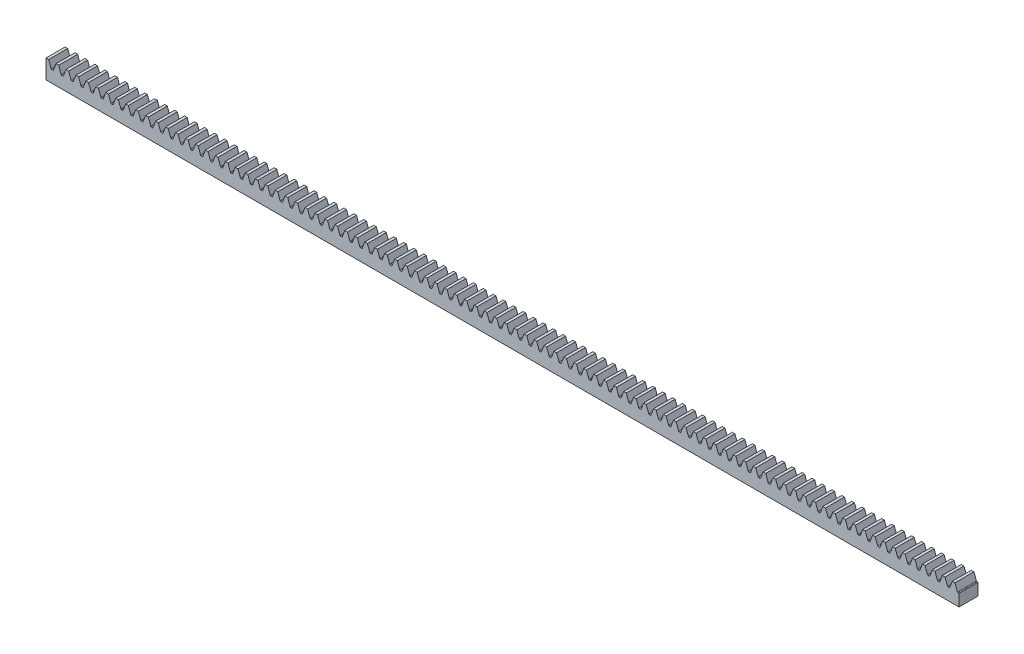
from build123d import *

# Parameters (mm, degrees)
BOSS_EXTRUDE1_DEPTH      = 152.4
BOSS_EXTRUDE1_DEPTH_BACK = 152.4
SKETCH3_W                = 6.35
SKETCH3_H                = 6.35
CUT_EXTRUDE1_DEPTH       = 153.466131485
FILLET1_R                = 0.210289869
LPATTERN1_START          = -3.175
LPATTERN1_DEPTH          = 6.35


# Read off the part's stored shape, not the designer's step: LPattern1
with BuildPart() as part:
    # Sketch3 → Boss-Extrude1 (new, two sides: drawn at the far end of the back side and taken through both)
    with BuildSketch(Plane(origin=(0, 0, 0), x_dir=(0, 0, -1), z_dir=(1, 0, 0)).offset(-BOSS_EXTRUDE1_DEPTH_BACK)):
        Rectangle(SKETCH3_W, SKETCH3_H)
    extrude(amount=BOSS_EXTRUDE1_DEPTH + BOSS_EXTRUDE1_DEPTH_BACK)

    # Sketch4 → Cut-Extrude1 (cut, symmetric)
    with BuildSketch(Plane.XY):
        Polygon((-151.507973663, 3.175), (-150.642039946, 0.795866667), (-149.941073717, 0.795866667), (-149.07514, 3.175), align=None)
    extrude(amount=CUT_EXTRUDE1_DEPTH, both=True, mode=Mode.SUBTRACT)

    # Fillet1
    fillet1_edges = [part.edges().sort_by_distance(p)[0] for p in [
        (-149.941073717, 0.795866667, 0),
        (-150.642039946, 0.795866667, 0),
    ]]
    fillet(fillet1_edges, radius=FILLET1_R)

    # LPattern1 outline → LPattern1 (cut)
    with BuildSketch(Plane.XY.offset(LPATTERN1_START)):
        with BuildLine():
            ThreePointArc((-147.367541232, 0.934233164), (-147.290550708, 0.83389716), (-147.169933395, 0.795866667))
            Line((-147.169933395, 0.795866667), (-146.763460268, 0.795866667))
            ThreePointArc((-146.763460268, 0.795866667), (-146.642842955, 0.83389716), (-146.56585243, 0.934233164))
            Line((-146.56585243, 0.934233164), (-145.75028, 3.175))
            Line((-145.75028, 3.175), (-148.183113663, 3.175))
            Line((-148.183113663, 3.175), (-147.367541232, 0.934233164))
        make_face()
        with BuildLine():
            Line((152.4, 3.175), (151.054286337, 3.175))
            Line((151.054286337, 3.175), (151.869858768, 0.934233164))
            ThreePointArc((151.869858768, 0.934233164), (151.946849292, 0.83389716), (152.067466605, 0.795866667))
            Line((152.067466605, 0.795866667), (152.4, 0.795866667))
            Line((152.4, 0.795866667), (152.4, 3.175))
        make_face()
        with BuildLine():
            Line((150.16226, 3.175), (147.729426337, 3.175))
            Line((147.729426337, 3.175), (148.544998768, 0.934233164))
            ThreePointArc((148.544998768, 0.934233164), (148.621989292, 0.83389716), (148.742606605, 0.795866667))
            Line((148.742606605, 0.795866667), (149.149079732, 0.795866667))
            ThreePointArc((149.149079732, 0.795866667), (149.269697045, 0.83389716), (149.34668757, 0.934233164))
            Line((149.34668757, 0.934233164), (150.16226, 3.175))
        make_face()
        with BuildLine():
            Line((146.8374, 3.175), (144.404566337, 3.175))
            Line((144.404566337, 3.175), (145.220138768, 0.934233164))
            ThreePointArc((145.220138768, 0.934233164), (145.297129292, 0.83389716), (145.417746605, 0.795866667))
            Line((145.417746605, 0.795866667), (145.824219732, 0.795866667))
            ThreePointArc((145.824219732, 0.795866667), (145.944837045, 0.83389716), (146.02182757, 0.934233164))
            Line((146.02182757, 0.934233164), (146.8374, 3.175))
        make_face()
        with BuildLine():
            Line((143.51254, 3.175), (141.079706337, 3.175))
            Line((141.079706337, 3.175), (141.895278768, 0.934233164))
            ThreePointArc((141.895278768, 0.934233164), (141.972269292, 0.83389716), (142.092886605, 0.795866667))
            Line((142.092886605, 0.795866667), (142.499359732, 0.795866667))
            ThreePointArc((142.499359732, 0.795866667), (142.619977045, 0.83389716), (142.69696757, 0.934233164))
            Line((142.69696757, 0.934233164), (143.51254, 3.175))
        make_face()
        with BuildLine():
            Line((140.18768, 3.175), (137.754846337, 3.175))
            Line((137.754846337, 3.175), (138.570418768, 0.934233164))
            ThreePointArc((138.570418768, 0.934233164), (138.647409292, 0.83389716), (138.768026605, 0.795866667))
            Line((138.768026605, 0.795866667), (139.174499732, 0.795866667))
            ThreePointArc((139.174499732, 0.795866667), (139.295117045, 0.83389716), (139.37210757, 0.934233164))
            Line((139.37210757, 0.934233164), (140.18768, 3.175))
        make_face()
        with BuildLine():
            Line((136.86282, 3.175), (134.429986337, 3.175))
            Line((134.429986337, 3.175), (135.245558768, 0.934233164))
            ThreePointArc((135.245558768, 0.934233164), (135.322549292, 0.83389716), (135.443166605, 0.795866667))
            Line((135.443166605, 0.795866667), (135.849639732, 0.795866667))
            ThreePointArc((135.849639732, 0.795866667), (135.970257045, 0.83389716), (136.04724757, 0.934233164))
            Line((136.04724757, 0.934233164), (136.86282, 3.175))
        make_face()
        with BuildLine():
            Line((133.53796, 3.175), (131.105126337, 3.175))
            Line((131.105126337, 3.175), (131.920698768, 0.934233164))
            ThreePointArc((131.920698768, 0.934233164), (131.997689292, 0.83389716), (132.118306605, 0.795866667))
            Line((132.118306605, 0.795866667), (132.524779732, 0.795866667))
            ThreePointArc((132.524779732, 0.795866667), (132.645397045, 0.83389716), (132.72238757, 0.934233164))
            Line((132.72238757, 0.934233164), (133.53796, 3.175))
        make_face()
        with BuildLine():
            Line((130.2131, 3.175), (127.780266337, 3.175))
            Line((127.780266337, 3.175), (128.595838768, 0.934233164))
            ThreePointArc((128.595838768, 0.934233164), (128.672829292, 0.83389716), (128.793446605, 0.795866667))
            Line((128.793446605, 0.795866667), (129.199919732, 0.795866667))
            ThreePointArc((129.199919732, 0.795866667), (129.320537045, 0.83389716), (129.39752757, 0.934233164))
            Line((129.39752757, 0.934233164), (130.2131, 3.175))
        make_face()
        with BuildLine():
            Line((126.88824, 3.175), (124.455406337, 3.175))
            Line((124.455406337, 3.175), (125.270978768, 0.934233164))
            ThreePointArc((125.270978768, 0.934233164), (125.347969292, 0.83389716), (125.468586605, 0.795866667))
            Line((125.468586605, 0.795866667), (125.875059732, 0.795866667))
            ThreePointArc((125.875059732, 0.795866667), (125.995677045, 0.83389716), (126.07266757, 0.934233164))
            Line((126.07266757, 0.934233164), (126.88824, 3.175))
        make_face()
        with BuildLine():
            Line((123.56338, 3.175), (121.130546337, 3.175))
            Line((121.130546337, 3.175), (121.946118768, 0.934233164))
            ThreePointArc((121.946118768, 0.934233164), (122.023109292, 0.83389716), (122.143726605, 0.795866667))
            Line((122.143726605, 0.795866667), (122.550199732, 0.795866667))
            ThreePointArc((122.550199732, 0.795866667), (122.670817045, 0.83389716), (122.74780757, 0.934233164))
            Line((122.74780757, 0.934233164), (123.56338, 3.175))
        make_face()
        with BuildLine():
            Line((120.23852, 3.175), (117.805686337, 3.175))
            Line((117.805686337, 3.175), (118.621258768, 0.934233164))
            ThreePointArc((118.621258768, 0.934233164), (118.698249292, 0.83389716), (118.818866605, 0.795866667))
            Line((118.818866605, 0.795866667), (119.225339732, 0.795866667))
            ThreePointArc((119.225339732, 0.795866667), (119.345957045, 0.83389716), (119.42294757, 0.934233164))
            Line((119.42294757, 0.934233164), (120.23852, 3.175))
        make_face()
        with BuildLine():
            Line((116.91366, 3.175), (114.480826337, 3.175))
            Line((114.480826337, 3.175), (115.296398768, 0.934233164))
            ThreePointArc((115.296398768, 0.934233164), (115.373389292, 0.83389716), (115.494006605, 0.795866667))
            Line((115.494006605, 0.795866667), (115.900479732, 0.795866667))
            ThreePointArc((115.900479732, 0.795866667), (116.021097045, 0.83389716), (116.09808757, 0.934233164))
            Line((116.09808757, 0.934233164), (116.91366, 3.175))
        make_face()
        with BuildLine():
            Line((113.5888, 3.175), (111.155966337, 3.175))
            Line((111.155966337, 3.175), (111.971538768, 0.934233164))
            ThreePointArc((111.971538768, 0.934233164), (112.048529292, 0.83389716), (112.169146605, 0.795866667))
            Line((112.169146605, 0.795866667), (112.575619732, 0.795866667))
            ThreePointArc((112.575619732, 0.795866667), (112.696237045, 0.83389716), (112.77322757, 0.934233164))
            Line((112.77322757, 0.934233164), (113.5888, 3.175))
        make_face()
        with BuildLine():
            Line((110.26394, 3.175), (107.831106337, 3.175))
            Line((107.831106337, 3.175), (108.646678768, 0.934233164))
            ThreePointArc((108.646678768, 0.934233164), (108.723669292, 0.83389716), (108.844286605, 0.795866667))
            Line((108.844286605, 0.795866667), (109.250759732, 0.795866667))
            ThreePointArc((109.250759732, 0.795866667), (109.371377045, 0.83389716), (109.44836757, 0.934233164))
            Line((109.44836757, 0.934233164), (110.26394, 3.175))
        make_face()
        with BuildLine():
            Line((106.93908, 3.175), (104.506246337, 3.175))
            Line((104.506246337, 3.175), (105.321818768, 0.934233164))
            ThreePointArc((105.321818768, 0.934233164), (105.398809292, 0.83389716), (105.519426605, 0.795866667))
            Line((105.519426605, 0.795866667), (105.925899732, 0.795866667))
            ThreePointArc((105.925899732, 0.795866667), (106.046517045, 0.83389716), (106.12350757, 0.934233164))
            Line((106.12350757, 0.934233164), (106.93908, 3.175))
        make_face()
        with BuildLine():
            Line((103.61422, 3.175), (101.181386337, 3.175))
            Line((101.181386337, 3.175), (101.996958768, 0.934233164))
            ThreePointArc((101.996958768, 0.934233164), (102.073949292, 0.83389716), (102.194566605, 0.795866667))
            Line((102.194566605, 0.795866667), (102.601039732, 0.795866667))
            ThreePointArc((102.601039732, 0.795866667), (102.721657045, 0.83389716), (102.79864757, 0.934233164))
            Line((102.79864757, 0.934233164), (103.61422, 3.175))
        make_face()
        with BuildLine():
            Line((100.28936, 3.175), (97.856526337, 3.175))
            Line((97.856526337, 3.175), (98.672098768, 0.934233164))
            ThreePointArc((98.672098768, 0.934233164), (98.749089292, 0.83389716), (98.869706605, 0.795866667))
            Line((98.869706605, 0.795866667), (99.276179732, 0.795866667))
            ThreePointArc((99.276179732, 0.795866667), (99.396797045, 0.83389716), (99.47378757, 0.934233164))
            Line((99.47378757, 0.934233164), (100.28936, 3.175))
        make_face()
        with BuildLine():
            Line((96.9645, 3.175), (94.531666337, 3.175))
            Line((94.531666337, 3.175), (95.347238768, 0.934233164))
            ThreePointArc((95.347238768, 0.934233164), (95.424229292, 0.83389716), (95.544846605, 0.795866667))
            Line((95.544846605, 0.795866667), (95.951319732, 0.795866667))
            ThreePointArc((95.951319732, 0.795866667), (96.071937045, 0.83389716), (96.14892757, 0.934233164))
            Line((96.14892757, 0.934233164), (96.9645, 3.175))
        make_face()
        with BuildLine():
            Line((93.63964, 3.175), (91.206806337, 3.175))
            Line((91.206806337, 3.175), (92.022378768, 0.934233164))
            ThreePointArc((92.022378768, 0.934233164), (92.099369292, 0.83389716), (92.219986605, 0.795866667))
            Line((92.219986605, 0.795866667), (92.626459732, 0.795866667))
            ThreePointArc((92.626459732, 0.795866667), (92.747077045, 0.83389716), (92.82406757, 0.934233164))
            Line((92.82406757, 0.934233164), (93.63964, 3.175))
        make_face()
        with BuildLine():
            Line((90.31478, 3.175), (87.881946337, 3.175))
            Line((87.881946337, 3.175), (88.697518768, 0.934233164))
            ThreePointArc((88.697518768, 0.934233164), (88.774509292, 0.83389716), (88.895126605, 0.795866667))
            Line((88.895126605, 0.795866667), (89.301599732, 0.795866667))
            ThreePointArc((89.301599732, 0.795866667), (89.422217045, 0.83389716), (89.49920757, 0.934233164))
            Line((89.49920757, 0.934233164), (90.31478, 3.175))
        make_face()
        with BuildLine():
            Line((86.98992, 3.175), (84.557086337, 3.175))
            Line((84.557086337, 3.175), (85.372658768, 0.934233164))
            ThreePointArc((85.372658768, 0.934233164), (85.449649292, 0.83389716), (85.570266605, 0.795866667))
            Line((85.570266605, 0.795866667), (85.976739732, 0.795866667))
            ThreePointArc((85.976739732, 0.795866667), (86.097357045, 0.83389716), (86.17434757, 0.934233164))
            Line((86.17434757, 0.934233164), (86.98992, 3.175))
        make_face()
        with BuildLine():
            Line((83.66506, 3.175), (81.232226337, 3.175))
            Line((81.232226337, 3.175), (82.047798768, 0.934233164))
            ThreePointArc((82.047798768, 0.934233164), (82.124789292, 0.83389716), (82.245406605, 0.795866667))
            Line((82.245406605, 0.795866667), (82.651879732, 0.795866667))
            ThreePointArc((82.651879732, 0.795866667), (82.772497045, 0.83389716), (82.84948757, 0.934233164))
            Line((82.84948757, 0.934233164), (83.66506, 3.175))
        make_face()
        with BuildLine():
            Line((80.3402, 3.175), (77.907366337, 3.175))
            Line((77.907366337, 3.175), (78.722938768, 0.934233164))
            ThreePointArc((78.722938768, 0.934233164), (78.799929292, 0.83389716), (78.920546605, 0.795866667))
            Line((78.920546605, 0.795866667), (79.327019732, 0.795866667))
            ThreePointArc((79.327019732, 0.795866667), (79.447637045, 0.83389716), (79.52462757, 0.934233164))
            Line((79.52462757, 0.934233164), (80.3402, 3.175))
        make_face()
        with BuildLine():
            Line((77.01534, 3.175), (74.582506337, 3.175))
            Line((74.582506337, 3.175), (75.398078768, 0.934233164))
            ThreePointArc((75.398078768, 0.934233164), (75.475069292, 0.83389716), (75.595686605, 0.795866667))
            Line((75.595686605, 0.795866667), (76.002159732, 0.795866667))
            ThreePointArc((76.002159732, 0.795866667), (76.122777045, 0.83389716), (76.19976757, 0.934233164))
            Line((76.19976757, 0.934233164), (77.01534, 3.175))
        make_face()
        with BuildLine():
            Line((73.69048, 3.175), (71.257646337, 3.175))
            Line((71.257646337, 3.175), (72.073218768, 0.934233164))
            ThreePointArc((72.073218768, 0.934233164), (72.150209292, 0.83389716), (72.270826605, 0.795866667))
            Line((72.270826605, 0.795866667), (72.677299732, 0.795866667))
            ThreePointArc((72.677299732, 0.795866667), (72.797917045, 0.83389716), (72.87490757, 0.934233164))
            Line((72.87490757, 0.934233164), (73.69048, 3.175))
        make_face()
        with BuildLine():
            Line((70.36562, 3.175), (67.932786337, 3.175))
            Line((67.932786337, 3.175), (68.748358768, 0.934233164))
            ThreePointArc((68.748358768, 0.934233164), (68.825349292, 0.83389716), (68.945966605, 0.795866667))
            Line((68.945966605, 0.795866667), (69.352439732, 0.795866667))
            ThreePointArc((69.352439732, 0.795866667), (69.473057045, 0.83389716), (69.55004757, 0.934233164))
            Line((69.55004757, 0.934233164), (70.36562, 3.175))
        make_face()
        with BuildLine():
            Line((67.04076, 3.175), (64.607926337, 3.175))
            Line((64.607926337, 3.175), (65.423498768, 0.934233164))
            ThreePointArc((65.423498768, 0.934233164), (65.500489292, 0.83389716), (65.621106605, 0.795866667))
            Line((65.621106605, 0.795866667), (66.027579732, 0.795866667))
            ThreePointArc((66.027579732, 0.795866667), (66.148197045, 0.83389716), (66.22518757, 0.934233164))
            Line((66.22518757, 0.934233164), (67.04076, 3.175))
        make_face()
        with BuildLine():
            Line((63.7159, 3.175), (61.283066337, 3.175))
            Line((61.283066337, 3.175), (62.098638768, 0.934233164))
            ThreePointArc((62.098638768, 0.934233164), (62.175629292, 0.83389716), (62.296246605, 0.795866667))
            Line((62.296246605, 0.795866667), (62.702719732, 0.795866667))
            ThreePointArc((62.702719732, 0.795866667), (62.823337045, 0.83389716), (62.90032757, 0.934233164))
            Line((62.90032757, 0.934233164), (63.7159, 3.175))
        make_face()
        with BuildLine():
            Line((60.39104, 3.175), (57.958206337, 3.175))
            Line((57.958206337, 3.175), (58.773778768, 0.934233164))
            ThreePointArc((58.773778768, 0.934233164), (58.850769292, 0.83389716), (58.971386605, 0.795866667))
            Line((58.971386605, 0.795866667), (59.377859732, 0.795866667))
            ThreePointArc((59.377859732, 0.795866667), (59.498477045, 0.83389716), (59.57546757, 0.934233164))
            Line((59.57546757, 0.934233164), (60.39104, 3.175))
        make_face()
        with BuildLine():
            Line((57.06618, 3.175), (54.633346337, 3.175))
            Line((54.633346337, 3.175), (55.448918768, 0.934233164))
            ThreePointArc((55.448918768, 0.934233164), (55.525909292, 0.83389716), (55.646526605, 0.795866667))
            Line((55.646526605, 0.795866667), (56.052999732, 0.795866667))
            ThreePointArc((56.052999732, 0.795866667), (56.173617045, 0.83389716), (56.25060757, 0.934233164))
            Line((56.25060757, 0.934233164), (57.06618, 3.175))
        make_face()
        with BuildLine():
            Line((53.74132, 3.175), (51.308486337, 3.175))
            Line((51.308486337, 3.175), (52.124058768, 0.934233164))
            ThreePointArc((52.124058768, 0.934233164), (52.201049292, 0.83389716), (52.321666605, 0.795866667))
            Line((52.321666605, 0.795866667), (52.728139732, 0.795866667))
            ThreePointArc((52.728139732, 0.795866667), (52.848757045, 0.83389716), (52.92574757, 0.934233164))
            Line((52.92574757, 0.934233164), (53.74132, 3.175))
        make_face()
        with BuildLine():
            Line((50.41646, 3.175), (47.983626337, 3.175))
            Line((47.983626337, 3.175), (48.799198768, 0.934233164))
            ThreePointArc((48.799198768, 0.934233164), (48.876189292, 0.83389716), (48.996806605, 0.795866667))
            Line((48.996806605, 0.795866667), (49.403279732, 0.795866667))
            ThreePointArc((49.403279732, 0.795866667), (49.523897045, 0.83389716), (49.60088757, 0.934233164))
            Line((49.60088757, 0.934233164), (50.41646, 3.175))
        make_face()
        with BuildLine():
            Line((47.0916, 3.175), (44.658766337, 3.175))
            Line((44.658766337, 3.175), (45.474338768, 0.934233164))
            ThreePointArc((45.474338768, 0.934233164), (45.551329292, 0.83389716), (45.671946605, 0.795866667))
            Line((45.671946605, 0.795866667), (46.078419732, 0.795866667))
            ThreePointArc((46.078419732, 0.795866667), (46.199037045, 0.83389716), (46.27602757, 0.934233164))
            Line((46.27602757, 0.934233164), (47.0916, 3.175))
        make_face()
        with BuildLine():
            Line((43.76674, 3.175), (41.333906337, 3.175))
            Line((41.333906337, 3.175), (42.149478768, 0.934233164))
            ThreePointArc((42.149478768, 0.934233164), (42.226469292, 0.83389716), (42.347086605, 0.795866667))
            Line((42.347086605, 0.795866667), (42.753559732, 0.795866667))
            ThreePointArc((42.753559732, 0.795866667), (42.874177045, 0.83389716), (42.95116757, 0.934233164))
            Line((42.95116757, 0.934233164), (43.76674, 3.175))
        make_face()
        with BuildLine():
            Line((40.44188, 3.175), (38.009046337, 3.175))
            Line((38.009046337, 3.175), (38.824618768, 0.934233164))
            ThreePointArc((38.824618768, 0.934233164), (38.901609292, 0.83389716), (39.022226605, 0.795866667))
            Line((39.022226605, 0.795866667), (39.428699732, 0.795866667))
            ThreePointArc((39.428699732, 0.795866667), (39.549317045, 0.83389716), (39.62630757, 0.934233164))
            Line((39.62630757, 0.934233164), (40.44188, 3.175))
        make_face()
        with BuildLine():
            Line((37.11702, 3.175), (34.684186337, 3.175))
            Line((34.684186337, 3.175), (35.499758768, 0.934233164))
            ThreePointArc((35.499758768, 0.934233164), (35.576749292, 0.83389716), (35.697366605, 0.795866667))
            Line((35.697366605, 0.795866667), (36.103839732, 0.795866667))
            ThreePointArc((36.103839732, 0.795866667), (36.224457045, 0.83389716), (36.30144757, 0.934233164))
            Line((36.30144757, 0.934233164), (37.11702, 3.175))
        make_face()
        with BuildLine():
            Line((33.79216, 3.175), (31.359326337, 3.175))
            Line((31.359326337, 3.175), (32.174898768, 0.934233164))
            ThreePointArc((32.174898768, 0.934233164), (32.251889292, 0.83389716), (32.372506605, 0.795866667))
            Line((32.372506605, 0.795866667), (32.778979732, 0.795866667))
            ThreePointArc((32.778979732, 0.795866667), (32.899597045, 0.83389716), (32.97658757, 0.934233164))
            Line((32.97658757, 0.934233164), (33.79216, 3.175))
        make_face()
        with BuildLine():
            Line((30.4673, 3.175), (28.034466337, 3.175))
            Line((28.034466337, 3.175), (28.850038768, 0.934233164))
            ThreePointArc((28.850038768, 0.934233164), (28.927029292, 0.83389716), (29.047646605, 0.795866667))
            Line((29.047646605, 0.795866667), (29.454119732, 0.795866667))
            ThreePointArc((29.454119732, 0.795866667), (29.574737045, 0.83389716), (29.65172757, 0.934233164))
            Line((29.65172757, 0.934233164), (30.4673, 3.175))
        make_face()
        with BuildLine():
            Line((27.14244, 3.175), (24.709606337, 3.175))
            Line((24.709606337, 3.175), (25.525178768, 0.934233164))
            ThreePointArc((25.525178768, 0.934233164), (25.602169292, 0.83389716), (25.722786605, 0.795866667))
            Line((25.722786605, 0.795866667), (26.129259732, 0.795866667))
            ThreePointArc((26.129259732, 0.795866667), (26.249877045, 0.83389716), (26.32686757, 0.934233164))
            Line((26.32686757, 0.934233164), (27.14244, 3.175))
        make_face()
        with BuildLine():
            Line((23.81758, 3.175), (21.384746337, 3.175))
            Line((21.384746337, 3.175), (22.200318768, 0.934233164))
            ThreePointArc((22.200318768, 0.934233164), (22.277309292, 0.83389716), (22.397926605, 0.795866667))
            Line((22.397926605, 0.795866667), (22.804399732, 0.795866667))
            ThreePointArc((22.804399732, 0.795866667), (22.925017045, 0.83389716), (23.00200757, 0.934233164))
            Line((23.00200757, 0.934233164), (23.81758, 3.175))
        make_face()
        with BuildLine():
            Line((20.49272, 3.175), (18.059886337, 3.175))
            Line((18.059886337, 3.175), (18.875458768, 0.934233164))
            ThreePointArc((18.875458768, 0.934233164), (18.952449292, 0.83389716), (19.073066605, 0.795866667))
            Line((19.073066605, 0.795866667), (19.479539732, 0.795866667))
            ThreePointArc((19.479539732, 0.795866667), (19.600157045, 0.83389716), (19.67714757, 0.934233164))
            Line((19.67714757, 0.934233164), (20.49272, 3.175))
        make_face()
        with BuildLine():
            Line((17.16786, 3.175), (14.735026337, 3.175))
            Line((14.735026337, 3.175), (15.550598768, 0.934233164))
            ThreePointArc((15.550598768, 0.934233164), (15.627589292, 0.83389716), (15.748206605, 0.795866667))
            Line((15.748206605, 0.795866667), (16.154679732, 0.795866667))
            ThreePointArc((16.154679732, 0.795866667), (16.275297045, 0.83389716), (16.35228757, 0.934233164))
            Line((16.35228757, 0.934233164), (17.16786, 3.175))
        make_face()
        with BuildLine():
            Line((13.843, 3.175), (11.410166337, 3.175))
            Line((11.410166337, 3.175), (12.225738768, 0.934233164))
            ThreePointArc((12.225738768, 0.934233164), (12.302729292, 0.83389716), (12.423346605, 0.795866667))
            Line((12.423346605, 0.795866667), (12.829819732, 0.795866667))
            ThreePointArc((12.829819732, 0.795866667), (12.950437045, 0.83389716), (13.02742757, 0.934233164))
            Line((13.02742757, 0.934233164), (13.843, 3.175))
        make_face()
        with BuildLine():
            Line((10.51814, 3.175), (8.085306337, 3.175))
            Line((8.085306337, 3.175), (8.900878768, 0.934233164))
            ThreePointArc((8.900878768, 0.934233164), (8.977869292, 0.83389716), (9.098486605, 0.795866667))
            Line((9.098486605, 0.795866667), (9.504959732, 0.795866667))
            ThreePointArc((9.504959732, 0.795866667), (9.625577045, 0.83389716), (9.70256757, 0.934233164))
            Line((9.70256757, 0.934233164), (10.51814, 3.175))
        make_face()
        with BuildLine():
            Line((7.19328, 3.175), (4.760446337, 3.175))
            Line((4.760446337, 3.175), (5.576018768, 0.934233164))
            ThreePointArc((5.576018768, 0.934233164), (5.653009292, 0.83389716), (5.773626605, 0.795866667))
            Line((5.773626605, 0.795866667), (6.180099732, 0.795866667))
            ThreePointArc((6.180099732, 0.795866667), (6.300717045, 0.83389716), (6.37770757, 0.934233164))
            Line((6.37770757, 0.934233164), (7.19328, 3.175))
        make_face()
        with BuildLine():
            Line((3.86842, 3.175), (1.435586337, 3.175))
            Line((1.435586337, 3.175), (2.251158768, 0.934233164))
            ThreePointArc((2.251158768, 0.934233164), (2.328149292, 0.83389716), (2.448766605, 0.795866667))
            Line((2.448766605, 0.795866667), (2.855239732, 0.795866667))
            ThreePointArc((2.855239732, 0.795866667), (2.975857045, 0.83389716), (3.05284757, 0.934233164))
            Line((3.05284757, 0.934233164), (3.86842, 3.175))
        make_face()
        with BuildLine():
            Line((0.54356, 3.175), (-1.889273663, 3.175))
            Line((-1.889273663, 3.175), (-1.073701232, 0.934233164))
            ThreePointArc((-1.073701232, 0.934233164), (-0.996710708, 0.83389716), (-0.876093395, 0.795866667))
            Line((-0.876093395, 0.795866667), (-0.469620268, 0.795866667))
            ThreePointArc((-0.469620268, 0.795866667), (-0.349002955, 0.83389716), (-0.27201243, 0.934233164))
            Line((-0.27201243, 0.934233164), (0.54356, 3.175))
        make_face()
        with BuildLine():
            Line((-2.7813, 3.175), (-5.214133663, 3.175))
            Line((-5.214133663, 3.175), (-4.398561232, 0.934233164))
            ThreePointArc((-4.398561232, 0.934233164), (-4.321570708, 0.83389716), (-4.200953395, 0.795866667))
            Line((-4.200953395, 0.795866667), (-3.794480268, 0.795866667))
            ThreePointArc((-3.794480268, 0.795866667), (-3.673862955, 0.83389716), (-3.59687243, 0.934233164))
            Line((-3.59687243, 0.934233164), (-2.7813, 3.175))
        make_face()
        with BuildLine():
            Line((-6.10616, 3.175), (-8.538993663, 3.175))
            Line((-8.538993663, 3.175), (-7.723421232, 0.934233164))
            ThreePointArc((-7.723421232, 0.934233164), (-7.646430708, 0.83389716), (-7.525813395, 0.795866667))
            Line((-7.525813395, 0.795866667), (-7.119340268, 0.795866667))
            ThreePointArc((-7.119340268, 0.795866667), (-6.998722955, 0.83389716), (-6.92173243, 0.934233164))
            Line((-6.92173243, 0.934233164), (-6.10616, 3.175))
        make_face()
        with BuildLine():
            Line((-9.43102, 3.175), (-11.863853663, 3.175))
            Line((-11.863853663, 3.175), (-11.048281232, 0.934233164))
            ThreePointArc((-11.048281232, 0.934233164), (-10.971290708, 0.83389716), (-10.850673395, 0.795866667))
            Line((-10.850673395, 0.795866667), (-10.444200268, 0.795866667))
            ThreePointArc((-10.444200268, 0.795866667), (-10.323582955, 0.83389716), (-10.24659243, 0.934233164))
            Line((-10.24659243, 0.934233164), (-9.43102, 3.175))
        make_face()
        with BuildLine():
            Line((-12.75588, 3.175), (-15.188713663, 3.175))
            Line((-15.188713663, 3.175), (-14.373141232, 0.934233164))
            ThreePointArc((-14.373141232, 0.934233164), (-14.296150708, 0.83389716), (-14.175533395, 0.795866667))
            Line((-14.175533395, 0.795866667), (-13.769060268, 0.795866667))
            ThreePointArc((-13.769060268, 0.795866667), (-13.648442955, 0.83389716), (-13.57145243, 0.934233164))
            Line((-13.57145243, 0.934233164), (-12.75588, 3.175))
        make_face()
        with BuildLine():
            Line((-16.08074, 3.175), (-18.513573663, 3.175))
            Line((-18.513573663, 3.175), (-17.698001232, 0.934233164))
            ThreePointArc((-17.698001232, 0.934233164), (-17.621010708, 0.83389716), (-17.500393395, 0.795866667))
            Line((-17.500393395, 0.795866667), (-17.093920268, 0.795866667))
            ThreePointArc((-17.093920268, 0.795866667), (-16.973302955, 0.83389716), (-16.89631243, 0.934233164))
            Line((-16.89631243, 0.934233164), (-16.08074, 3.175))
        make_face()
        with BuildLine():
            Line((-19.4056, 3.175), (-21.838433663, 3.175))
            Line((-21.838433663, 3.175), (-21.022861232, 0.934233164))
            ThreePointArc((-21.022861232, 0.934233164), (-20.945870708, 0.83389716), (-20.825253395, 0.795866667))
            Line((-20.825253395, 0.795866667), (-20.418780268, 0.795866667))
            ThreePointArc((-20.418780268, 0.795866667), (-20.298162955, 0.83389716), (-20.22117243, 0.934233164))
            Line((-20.22117243, 0.934233164), (-19.4056, 3.175))
        make_face()
        with BuildLine():
            Line((-22.73046, 3.175), (-25.163293663, 3.175))
            Line((-25.163293663, 3.175), (-24.347721232, 0.934233164))
            ThreePointArc((-24.347721232, 0.934233164), (-24.270730708, 0.83389716), (-24.150113395, 0.795866667))
            Line((-24.150113395, 0.795866667), (-23.743640268, 0.795866667))
            ThreePointArc((-23.743640268, 0.795866667), (-23.623022955, 0.83389716), (-23.54603243, 0.934233164))
            Line((-23.54603243, 0.934233164), (-22.73046, 3.175))
        make_face()
        with BuildLine():
            Line((-26.05532, 3.175), (-28.488153663, 3.175))
            Line((-28.488153663, 3.175), (-27.672581232, 0.934233164))
            ThreePointArc((-27.672581232, 0.934233164), (-27.595590708, 0.83389716), (-27.474973395, 0.795866667))
            Line((-27.474973395, 0.795866667), (-27.068500268, 0.795866667))
            ThreePointArc((-27.068500268, 0.795866667), (-26.947882955, 0.83389716), (-26.87089243, 0.934233164))
            Line((-26.87089243, 0.934233164), (-26.05532, 3.175))
        make_face()
        with BuildLine():
            Line((-29.38018, 3.175), (-31.813013663, 3.175))
            Line((-31.813013663, 3.175), (-30.997441232, 0.934233164))
            ThreePointArc((-30.997441232, 0.934233164), (-30.920450708, 0.83389716), (-30.799833395, 0.795866667))
            Line((-30.799833395, 0.795866667), (-30.393360268, 0.795866667))
            ThreePointArc((-30.393360268, 0.795866667), (-30.272742955, 0.83389716), (-30.19575243, 0.934233164))
            Line((-30.19575243, 0.934233164), (-29.38018, 3.175))
        make_face()
        with BuildLine():
            Line((-32.70504, 3.175), (-35.137873663, 3.175))
            Line((-35.137873663, 3.175), (-34.322301232, 0.934233164))
            ThreePointArc((-34.322301232, 0.934233164), (-34.245310708, 0.83389716), (-34.124693395, 0.795866667))
            Line((-34.124693395, 0.795866667), (-33.718220268, 0.795866667))
            ThreePointArc((-33.718220268, 0.795866667), (-33.597602955, 0.83389716), (-33.52061243, 0.934233164))
            Line((-33.52061243, 0.934233164), (-32.70504, 3.175))
        make_face()
        with BuildLine():
            Line((-36.0299, 3.175), (-38.462733663, 3.175))
            Line((-38.462733663, 3.175), (-37.647161232, 0.934233164))
            ThreePointArc((-37.647161232, 0.934233164), (-37.570170708, 0.83389716), (-37.449553395, 0.795866667))
            Line((-37.449553395, 0.795866667), (-37.043080268, 0.795866667))
            ThreePointArc((-37.043080268, 0.795866667), (-36.922462955, 0.83389716), (-36.84547243, 0.934233164))
            Line((-36.84547243, 0.934233164), (-36.0299, 3.175))
        make_face()
        with BuildLine():
            Line((-39.35476, 3.175), (-41.787593663, 3.175))
            Line((-41.787593663, 3.175), (-40.972021232, 0.934233164))
            ThreePointArc((-40.972021232, 0.934233164), (-40.895030708, 0.83389716), (-40.774413395, 0.795866667))
            Line((-40.774413395, 0.795866667), (-40.367940268, 0.795866667))
            ThreePointArc((-40.367940268, 0.795866667), (-40.247322955, 0.83389716), (-40.17033243, 0.934233164))
            Line((-40.17033243, 0.934233164), (-39.35476, 3.175))
        make_face()
        with BuildLine():
            Line((-42.67962, 3.175), (-45.112453663, 3.175))
            Line((-45.112453663, 3.175), (-44.296881232, 0.934233164))
            ThreePointArc((-44.296881232, 0.934233164), (-44.219890708, 0.83389716), (-44.099273395, 0.795866667))
            Line((-44.099273395, 0.795866667), (-43.692800268, 0.795866667))
            ThreePointArc((-43.692800268, 0.795866667), (-43.572182955, 0.83389716), (-43.49519243, 0.934233164))
            Line((-43.49519243, 0.934233164), (-42.67962, 3.175))
        make_face()
        with BuildLine():
            Line((-46.00448, 3.175), (-48.437313663, 3.175))
            Line((-48.437313663, 3.175), (-47.621741232, 0.934233164))
            ThreePointArc((-47.621741232, 0.934233164), (-47.544750708, 0.83389716), (-47.424133395, 0.795866667))
            Line((-47.424133395, 0.795866667), (-47.017660268, 0.795866667))
            ThreePointArc((-47.017660268, 0.795866667), (-46.897042955, 0.83389716), (-46.82005243, 0.934233164))
            Line((-46.82005243, 0.934233164), (-46.00448, 3.175))
        make_face()
        with BuildLine():
            Line((-49.32934, 3.175), (-51.762173663, 3.175))
            Line((-51.762173663, 3.175), (-50.946601232, 0.934233164))
            ThreePointArc((-50.946601232, 0.934233164), (-50.869610708, 0.83389716), (-50.748993395, 0.795866667))
            Line((-50.748993395, 0.795866667), (-50.342520268, 0.795866667))
            ThreePointArc((-50.342520268, 0.795866667), (-50.221902955, 0.83389716), (-50.14491243, 0.934233164))
            Line((-50.14491243, 0.934233164), (-49.32934, 3.175))
        make_face()
        with BuildLine():
            Line((-52.6542, 3.175), (-55.087033663, 3.175))
            Line((-55.087033663, 3.175), (-54.271461232, 0.934233164))
            ThreePointArc((-54.271461232, 0.934233164), (-54.194470708, 0.83389716), (-54.073853395, 0.795866667))
            Line((-54.073853395, 0.795866667), (-53.667380268, 0.795866667))
            ThreePointArc((-53.667380268, 0.795866667), (-53.546762955, 0.83389716), (-53.46977243, 0.934233164))
            Line((-53.46977243, 0.934233164), (-52.6542, 3.175))
        make_face()
        with BuildLine():
            Line((-55.97906, 3.175), (-58.411893663, 3.175))
            Line((-58.411893663, 3.175), (-57.596321232, 0.934233164))
            ThreePointArc((-57.596321232, 0.934233164), (-57.519330708, 0.83389716), (-57.398713395, 0.795866667))
            Line((-57.398713395, 0.795866667), (-56.992240268, 0.795866667))
            ThreePointArc((-56.992240268, 0.795866667), (-56.871622955, 0.83389716), (-56.79463243, 0.934233164))
            Line((-56.79463243, 0.934233164), (-55.97906, 3.175))
        make_face()
        with BuildLine():
            Line((-59.30392, 3.175), (-61.736753663, 3.175))
            Line((-61.736753663, 3.175), (-60.921181232, 0.934233164))
            ThreePointArc((-60.921181232, 0.934233164), (-60.844190708, 0.83389716), (-60.723573395, 0.795866667))
            Line((-60.723573395, 0.795866667), (-60.317100268, 0.795866667))
            ThreePointArc((-60.317100268, 0.795866667), (-60.196482955, 0.83389716), (-60.11949243, 0.934233164))
            Line((-60.11949243, 0.934233164), (-59.30392, 3.175))
        make_face()
        with BuildLine():
            Line((-62.62878, 3.175), (-65.061613663, 3.175))
            Line((-65.061613663, 3.175), (-64.246041232, 0.934233164))
            ThreePointArc((-64.246041232, 0.934233164), (-64.169050708, 0.83389716), (-64.048433395, 0.795866667))
            Line((-64.048433395, 0.795866667), (-63.641960268, 0.795866667))
            ThreePointArc((-63.641960268, 0.795866667), (-63.521342955, 0.83389716), (-63.44435243, 0.934233164))
            Line((-63.44435243, 0.934233164), (-62.62878, 3.175))
        make_face()
        with BuildLine():
            Line((-65.95364, 3.175), (-68.386473663, 3.175))
            Line((-68.386473663, 3.175), (-67.570901232, 0.934233164))
            ThreePointArc((-67.570901232, 0.934233164), (-67.493910708, 0.83389716), (-67.373293395, 0.795866667))
            Line((-67.373293395, 0.795866667), (-66.966820268, 0.795866667))
            ThreePointArc((-66.966820268, 0.795866667), (-66.846202955, 0.83389716), (-66.76921243, 0.934233164))
            Line((-66.76921243, 0.934233164), (-65.95364, 3.175))
        make_face()
        with BuildLine():
            Line((-69.2785, 3.175), (-71.711333663, 3.175))
            Line((-71.711333663, 3.175), (-70.895761232, 0.934233164))
            ThreePointArc((-70.895761232, 0.934233164), (-70.818770708, 0.83389716), (-70.698153395, 0.795866667))
            Line((-70.698153395, 0.795866667), (-70.291680268, 0.795866667))
            ThreePointArc((-70.291680268, 0.795866667), (-70.171062955, 0.83389716), (-70.09407243, 0.934233164))
            Line((-70.09407243, 0.934233164), (-69.2785, 3.175))
        make_face()
        with BuildLine():
            Line((-72.60336, 3.175), (-75.036193663, 3.175))
            Line((-75.036193663, 3.175), (-74.220621232, 0.934233164))
            ThreePointArc((-74.220621232, 0.934233164), (-74.143630708, 0.83389716), (-74.023013395, 0.795866667))
            Line((-74.023013395, 0.795866667), (-73.616540268, 0.795866667))
            ThreePointArc((-73.616540268, 0.795866667), (-73.495922955, 0.83389716), (-73.41893243, 0.934233164))
            Line((-73.41893243, 0.934233164), (-72.60336, 3.175))
        make_face()
        with BuildLine():
            Line((-75.92822, 3.175), (-78.361053663, 3.175))
            Line((-78.361053663, 3.175), (-77.545481232, 0.934233164))
            ThreePointArc((-77.545481232, 0.934233164), (-77.468490708, 0.83389716), (-77.347873395, 0.795866667))
            Line((-77.347873395, 0.795866667), (-76.941400268, 0.795866667))
            ThreePointArc((-76.941400268, 0.795866667), (-76.820782955, 0.83389716), (-76.74379243, 0.934233164))
            Line((-76.74379243, 0.934233164), (-75.92822, 3.175))
        make_face()
        with BuildLine():
            Line((-79.25308, 3.175), (-81.685913663, 3.175))
            Line((-81.685913663, 3.175), (-80.870341232, 0.934233164))
            ThreePointArc((-80.870341232, 0.934233164), (-80.793350708, 0.83389716), (-80.672733395, 0.795866667))
            Line((-80.672733395, 0.795866667), (-80.266260268, 0.795866667))
            ThreePointArc((-80.266260268, 0.795866667), (-80.145642955, 0.83389716), (-80.06865243, 0.934233164))
            Line((-80.06865243, 0.934233164), (-79.25308, 3.175))
        make_face()
        with BuildLine():
            Line((-82.57794, 3.175), (-85.010773663, 3.175))
            Line((-85.010773663, 3.175), (-84.195201232, 0.934233164))
            ThreePointArc((-84.195201232, 0.934233164), (-84.118210708, 0.83389716), (-83.997593395, 0.795866667))
            Line((-83.997593395, 0.795866667), (-83.591120268, 0.795866667))
            ThreePointArc((-83.591120268, 0.795866667), (-83.470502955, 0.83389716), (-83.39351243, 0.934233164))
            Line((-83.39351243, 0.934233164), (-82.57794, 3.175))
        make_face()
        with BuildLine():
            Line((-85.9028, 3.175), (-88.335633663, 3.175))
            Line((-88.335633663, 3.175), (-87.520061232, 0.934233164))
            ThreePointArc((-87.520061232, 0.934233164), (-87.443070708, 0.83389716), (-87.322453395, 0.795866667))
            Line((-87.322453395, 0.795866667), (-86.915980268, 0.795866667))
            ThreePointArc((-86.915980268, 0.795866667), (-86.795362955, 0.83389716), (-86.71837243, 0.934233164))
            Line((-86.71837243, 0.934233164), (-85.9028, 3.175))
        make_face()
        with BuildLine():
            Line((-89.22766, 3.175), (-91.660493663, 3.175))
            Line((-91.660493663, 3.175), (-90.844921232, 0.934233164))
            ThreePointArc((-90.844921232, 0.934233164), (-90.767930708, 0.83389716), (-90.647313395, 0.795866667))
            Line((-90.647313395, 0.795866667), (-90.240840268, 0.795866667))
            ThreePointArc((-90.240840268, 0.795866667), (-90.120222955, 0.83389716), (-90.04323243, 0.934233164))
            Line((-90.04323243, 0.934233164), (-89.22766, 3.175))
        make_face()
        with BuildLine():
            Line((-92.55252, 3.175), (-94.985353663, 3.175))
            Line((-94.985353663, 3.175), (-94.169781232, 0.934233164))
            ThreePointArc((-94.169781232, 0.934233164), (-94.092790708, 0.83389716), (-93.972173395, 0.795866667))
            Line((-93.972173395, 0.795866667), (-93.565700268, 0.795866667))
            ThreePointArc((-93.565700268, 0.795866667), (-93.445082955, 0.83389716), (-93.36809243, 0.934233164))
            Line((-93.36809243, 0.934233164), (-92.55252, 3.175))
        make_face()
        with BuildLine():
            Line((-95.87738, 3.175), (-98.310213663, 3.175))
            Line((-98.310213663, 3.175), (-97.494641232, 0.934233164))
            ThreePointArc((-97.494641232, 0.934233164), (-97.417650708, 0.83389716), (-97.297033395, 0.795866667))
            Line((-97.297033395, 0.795866667), (-96.890560268, 0.795866667))
            ThreePointArc((-96.890560268, 0.795866667), (-96.769942955, 0.83389716), (-96.69295243, 0.934233164))
            Line((-96.69295243, 0.934233164), (-95.87738, 3.175))
        make_face()
        with BuildLine():
            Line((-99.20224, 3.175), (-101.635073663, 3.175))
            Line((-101.635073663, 3.175), (-100.819501232, 0.934233164))
            ThreePointArc((-100.819501232, 0.934233164), (-100.742510708, 0.83389716), (-100.621893395, 0.795866667))
            Line((-100.621893395, 0.795866667), (-100.215420268, 0.795866667))
            ThreePointArc((-100.215420268, 0.795866667), (-100.094802955, 0.83389716), (-100.01781243, 0.934233164))
            Line((-100.01781243, 0.934233164), (-99.20224, 3.175))
        make_face()
        with BuildLine():
            Line((-102.5271, 3.175), (-104.959933663, 3.175))
            Line((-104.959933663, 3.175), (-104.144361232, 0.934233164))
            ThreePointArc((-104.144361232, 0.934233164), (-104.067370708, 0.83389716), (-103.946753395, 0.795866667))
            Line((-103.946753395, 0.795866667), (-103.540280268, 0.795866667))
            ThreePointArc((-103.540280268, 0.795866667), (-103.419662955, 0.83389716), (-103.34267243, 0.934233164))
            Line((-103.34267243, 0.934233164), (-102.5271, 3.175))
        make_face()
        with BuildLine():
            Line((-105.85196, 3.175), (-108.284793663, 3.175))
            Line((-108.284793663, 3.175), (-107.469221232, 0.934233164))
            ThreePointArc((-107.469221232, 0.934233164), (-107.392230708, 0.83389716), (-107.271613395, 0.795866667))
            Line((-107.271613395, 0.795866667), (-106.865140268, 0.795866667))
            ThreePointArc((-106.865140268, 0.795866667), (-106.744522955, 0.83389716), (-106.66753243, 0.934233164))
            Line((-106.66753243, 0.934233164), (-105.85196, 3.175))
        make_face()
        with BuildLine():
            Line((-109.17682, 3.175), (-111.609653663, 3.175))
            Line((-111.609653663, 3.175), (-110.794081232, 0.934233164))
            ThreePointArc((-110.794081232, 0.934233164), (-110.717090708, 0.83389716), (-110.596473395, 0.795866667))
            Line((-110.596473395, 0.795866667), (-110.190000268, 0.795866667))
            ThreePointArc((-110.190000268, 0.795866667), (-110.069382955, 0.83389716), (-109.99239243, 0.934233164))
            Line((-109.99239243, 0.934233164), (-109.17682, 3.175))
        make_face()
        with BuildLine():
            Line((-112.50168, 3.175), (-114.934513663, 3.175))
            Line((-114.934513663, 3.175), (-114.118941232, 0.934233164))
            ThreePointArc((-114.118941232, 0.934233164), (-114.041950708, 0.83389716), (-113.921333395, 0.795866667))
            Line((-113.921333395, 0.795866667), (-113.514860268, 0.795866667))
            ThreePointArc((-113.514860268, 0.795866667), (-113.394242955, 0.83389716), (-113.31725243, 0.934233164))
            Line((-113.31725243, 0.934233164), (-112.50168, 3.175))
        make_face()
        with BuildLine():
            Line((-115.82654, 3.175), (-118.259373663, 3.175))
            Line((-118.259373663, 3.175), (-117.443801232, 0.934233164))
            ThreePointArc((-117.443801232, 0.934233164), (-117.366810708, 0.83389716), (-117.246193395, 0.795866667))
            Line((-117.246193395, 0.795866667), (-116.839720268, 0.795866667))
            ThreePointArc((-116.839720268, 0.795866667), (-116.719102955, 0.83389716), (-116.64211243, 0.934233164))
            Line((-116.64211243, 0.934233164), (-115.82654, 3.175))
        make_face()
        with BuildLine():
            Line((-119.1514, 3.175), (-121.584233663, 3.175))
            Line((-121.584233663, 3.175), (-120.768661232, 0.934233164))
            ThreePointArc((-120.768661232, 0.934233164), (-120.691670708, 0.83389716), (-120.571053395, 0.795866667))
            Line((-120.571053395, 0.795866667), (-120.164580268, 0.795866667))
            ThreePointArc((-120.164580268, 0.795866667), (-120.043962955, 0.83389716), (-119.96697243, 0.934233164))
            Line((-119.96697243, 0.934233164), (-119.1514, 3.175))
        make_face()
        with BuildLine():
            Line((-122.47626, 3.175), (-124.909093663, 3.175))
            Line((-124.909093663, 3.175), (-124.093521232, 0.934233164))
            ThreePointArc((-124.093521232, 0.934233164), (-124.016530708, 0.83389716), (-123.895913395, 0.795866667))
            Line((-123.895913395, 0.795866667), (-123.489440268, 0.795866667))
            ThreePointArc((-123.489440268, 0.795866667), (-123.368822955, 0.83389716), (-123.29183243, 0.934233164))
            Line((-123.29183243, 0.934233164), (-122.47626, 3.175))
        make_face()
        with BuildLine():
            Line((-125.80112, 3.175), (-128.233953663, 3.175))
            Line((-128.233953663, 3.175), (-127.418381232, 0.934233164))
            ThreePointArc((-127.418381232, 0.934233164), (-127.341390708, 0.83389716), (-127.220773395, 0.795866667))
            Line((-127.220773395, 0.795866667), (-126.814300268, 0.795866667))
            ThreePointArc((-126.814300268, 0.795866667), (-126.693682955, 0.83389716), (-126.61669243, 0.934233164))
            Line((-126.61669243, 0.934233164), (-125.80112, 3.175))
        make_face()
        with BuildLine():
            Line((-129.12598, 3.175), (-131.558813663, 3.175))
            Line((-131.558813663, 3.175), (-130.743241232, 0.934233164))
            ThreePointArc((-130.743241232, 0.934233164), (-130.666250708, 0.83389716), (-130.545633395, 0.795866667))
            Line((-130.545633395, 0.795866667), (-130.139160268, 0.795866667))
            ThreePointArc((-130.139160268, 0.795866667), (-130.018542955, 0.83389716), (-129.94155243, 0.934233164))
            Line((-129.94155243, 0.934233164), (-129.12598, 3.175))
        make_face()
        with BuildLine():
            Line((-132.45084, 3.175), (-134.883673663, 3.175))
            Line((-134.883673663, 3.175), (-134.068101232, 0.934233164))
            ThreePointArc((-134.068101232, 0.934233164), (-133.991110708, 0.83389716), (-133.870493395, 0.795866667))
            Line((-133.870493395, 0.795866667), (-133.464020268, 0.795866667))
            ThreePointArc((-133.464020268, 0.795866667), (-133.343402955, 0.83389716), (-133.26641243, 0.934233164))
            Line((-133.26641243, 0.934233164), (-132.45084, 3.175))
        make_face()
        with BuildLine():
            Line((-135.7757, 3.175), (-138.208533663, 3.175))
            Line((-138.208533663, 3.175), (-137.392961232, 0.934233164))
            ThreePointArc((-137.392961232, 0.934233164), (-137.315970708, 0.83389716), (-137.195353395, 0.795866667))
            Line((-137.195353395, 0.795866667), (-136.788880268, 0.795866667))
            ThreePointArc((-136.788880268, 0.795866667), (-136.668262955, 0.83389716), (-136.59127243, 0.934233164))
            Line((-136.59127243, 0.934233164), (-135.7757, 3.175))
        make_face()
        with BuildLine():
            Line((-139.10056, 3.175), (-141.533393663, 3.175))
            Line((-141.533393663, 3.175), (-140.717821232, 0.934233164))
            ThreePointArc((-140.717821232, 0.934233164), (-140.640830708, 0.83389716), (-140.520213395, 0.795866667))
            Line((-140.520213395, 0.795866667), (-140.113740268, 0.795866667))
            ThreePointArc((-140.113740268, 0.795866667), (-139.993122955, 0.83389716), (-139.91613243, 0.934233164))
            Line((-139.91613243, 0.934233164), (-139.10056, 3.175))
        make_face()
        with BuildLine():
            Line((-142.42542, 3.175), (-144.858253663, 3.175))
            Line((-144.858253663, 3.175), (-144.042681232, 0.934233164))
            ThreePointArc((-144.042681232, 0.934233164), (-143.965690708, 0.83389716), (-143.845073395, 0.795866667))
            Line((-143.845073395, 0.795866667), (-143.438600268, 0.795866667))
            ThreePointArc((-143.438600268, 0.795866667), (-143.317982955, 0.83389716), (-143.24099243, 0.934233164))
            Line((-143.24099243, 0.934233164), (-142.42542, 3.175))
        make_face()
    extrude(amount=LPATTERN1_DEPTH, mode=Mode.SUBTRACT)


solid = part.part
